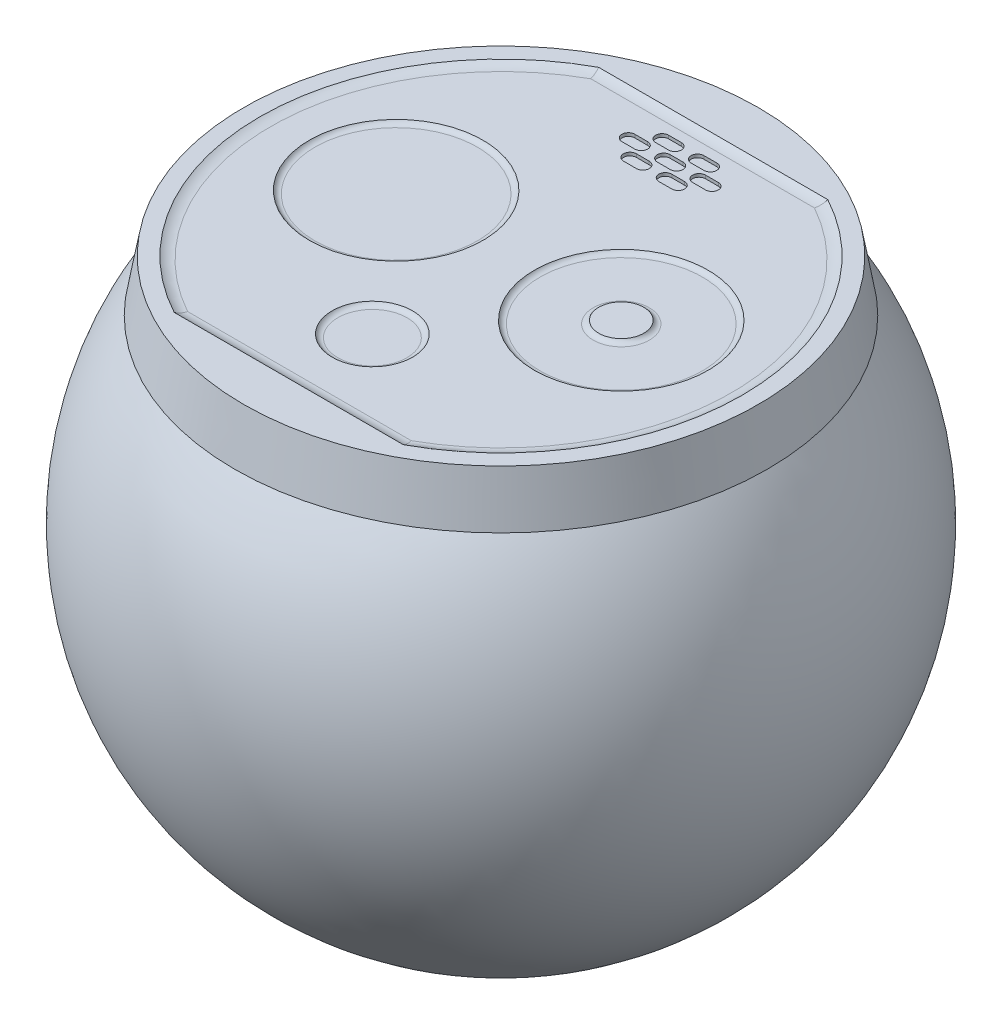
from build123d import *

# Parameters (mm, degrees)
EXTRUDE1_DEPTH = 0.5
FILLET1_R      = 3
SKETCH3_R      = 13.5
SKETCH3_R_2    = 3.5
SKETCH3_R_3    = 6.25
EXTRUDE2_DEPTH = 0.5
FILLET2_R      = 1


with BuildPart() as part:
    # Sketch1 → Revolve1 (revolve)
    with BuildSketch(Plane(origin=(0, 0, 0), x_dir=(0, 0, -1), z_dir=(1, 0, 0))):
        with BuildLine():
            Line((40, 36), (41.424630354, 28))
            ThreePointArc((41.424630354, 28), (44.158804332, -23.452078799), (0, -50))
            Line((0, -50), (0, 36))
            Line((0, 36), (40, 36))
        make_face()
    revolve(axis=Axis((0, 36, 0), (0, -1, 0)))

    # Sketch2 → Extrude1 (cut)
    with BuildSketch(Plane(origin=(0, 36, 0), x_dir=(1, 0, 0), z_dir=(0, 1, 0))):
        with BuildLine():
            Line((17.811513131, 33), (-17.811513131, 33))
            ThreePointArc((-17.811513131, 33), (-37.5, 0), (-17.811513131, -33))
            Line((-17.811513131, -33), (17.811513131, -33))
            ThreePointArc((17.811513131, -33), (32.20389528, -19.213514223), (37.5, 0))
            ThreePointArc((37.5, 0), (32.20389528, 19.213514223), (17.811513131, 33))
        make_face()
    extrude(amount=-EXTRUDE1_DEPTH, mode=Mode.SUBTRACT)

    # Fillet1
    # the kernel refuses this fillet: 3 mm, written as the material it adds along each edge
    with BuildSketch(Plane(origin=(-21.957294119, 35.5, 33), x_dir=(0, 1.0, -3.3253400033406348e-12), z_dir=(1, 0, 0)), Plane(origin=(21.957294119, 35.5, -33), x_dir=(0, 1.0, 3.3253400033406348e-12), z_dir=(-1, 0, 0))) as fillet1_piece_1:
        with BuildLine():
            CenterArc((3, -1.658312395), FILLET1_R, 146.442690238, 33.557309762)
            Line((0, -1.658312395), (0, 0))
            Line((0, 0), (0.5, 0))
        make_face()
    extrude(amount=43.914588237)
    with BuildSketch(Plane(origin=(0, 35.5, 0), x_dir=(0.37490714563861727, 0, 0.9270623669144945), z_dir=(-0.9270623669144945, 0, 0.37490714563861727))) as fillet1_piece_2:
        with BuildLine():
            CenterArc((35.841687605, 3), FILLET1_R, 270, 33.557309762)
            Line((35.841687605, 0), (37.5, 0))
            Line((37.5, 0), (37.5, 0.5))
        make_face()
    revolve(axis=Axis((0, 35.5, 0), (0, 1, 0)), revolution_arc=135.962852024)
    with BuildSketch(Plane(origin=(0, 35.5, 0), x_dir=(-0.37490714563861693, 0, -0.9270623669144946), z_dir=(0.9270623669144946, 0, -0.37490714563861693))) as fillet1_piece_3:
        with BuildLine():
            CenterArc((35.841687605, 3), FILLET1_R, 270, 33.557309762)
            Line((35.841687605, 0), (37.5, 0))
            Line((37.5, 0), (37.5, 0.5))
        make_face()
    revolve(axis=Axis((0, 35.5, 0), (0, 1, 0)), revolution_arc=135.962852024)

    # Sketch3 → Extrude2 (cut)
    # profile 1 of 10: a face of its own
    with BuildSketch(Plane(origin=(0, 35.5, 0), x_dir=(1, 0, 0), z_dir=(0, 1, 0))):
        with Locations(Location((-17.5, 1.2, 0), (0, 0, 270))):
            Circle(SKETCH3_R)
    # profile 2 of 10: a face of its own
    with BuildSketch(Plane(origin=(0, 35.5, 0), x_dir=(1, 0, 0), z_dir=(0, 1, 0))):
        with Locations(Location((17.5, 1.2, 0), (0, 0, 270))):
            Circle(SKETCH3_R)
        with Locations(Location((17.5, 1.2, 0), (0, 0, 270))):
            Circle(SKETCH3_R_2, mode=Mode.SUBTRACT)
    # profile 3 of 10: a face of its own
    with BuildSketch(Plane(origin=(0, 35.5, 0), x_dir=(1, 0, 0), z_dir=(0, 1, 0))):
        with Locations(Location((0, -20, 0), (0, 0, 270))):
            Circle(SKETCH3_R_3)
    # profile 4 of 10: a face of its own
    with BuildSketch(Plane(origin=(0, 35.5, 0), x_dir=(1, 0, 0), z_dir=(0, 1, 0))):
        with BuildLine():
            Line((-3.75, 24.8), (-1.75, 24.8))
            ThreePointArc((-1.75, 24.8), (-0.75, 23.8), (-1.75, 22.8))
            Line((-1.75, 22.8), (-3.75, 22.8))
            ThreePointArc((-3.75, 22.8), (-4.75, 23.8), (-3.75, 24.8))
        make_face()
    # profile 5 of 10: a face of its own
    with BuildSketch(Plane(origin=(0, 35.5, 0), x_dir=(1, 0, 0), z_dir=(0, 1, 0))):
        with BuildLine():
            Line((-6.5, 27.3), (-4.5, 27.3))
            ThreePointArc((-4.5, 27.3), (-3.5, 26.3), (-4.5, 25.3))
            Line((-4.5, 25.3), (-6.5, 25.3))
            ThreePointArc((-6.5, 25.3), (-7.5, 26.3), (-6.5, 27.3))
        make_face()
    # profile 6 of 10: a face of its own
    with BuildSketch(Plane(origin=(0, 35.5, 0), x_dir=(1, 0, 0), z_dir=(0, 1, 0))):
        with BuildLine():
            Line((-1, 27.3), (1, 27.3))
            ThreePointArc((1, 27.3), (2, 26.3), (1, 25.3))
            Line((1, 25.3), (-1, 25.3))
            ThreePointArc((-1, 25.3), (-2, 26.3), (-1, 27.3))
        make_face()
    # profile 7 of 10: a face of its own
    with BuildSketch(Plane(origin=(0, 35.5, 0), x_dir=(1, 0, 0), z_dir=(0, 1, 0))):
        with BuildLine():
            Line((-3.75, 29.8), (-1.75, 29.8))
            ThreePointArc((-1.75, 29.8), (-0.75, 28.8), (-1.75, 27.8))
            Line((-1.75, 27.8), (-3.75, 27.8))
            ThreePointArc((-3.75, 27.8), (-4.75, 28.8), (-3.75, 29.8))
        make_face()
    # profile 8 of 10: a face of its own
    with BuildSketch(Plane(origin=(0, 35.5, 0), x_dir=(1, 0, 0), z_dir=(0, 1, 0))):
        with BuildLine():
            Line((1.75, 29.8), (3.75, 29.8))
            ThreePointArc((3.75, 29.8), (4.75, 28.8), (3.75, 27.8))
            Line((3.75, 27.8), (1.75, 27.8))
            ThreePointArc((1.75, 27.8), (0.75, 28.8), (1.75, 29.8))
        make_face()
    # profile 9 of 10: a face of its own
    with BuildSketch(Plane(origin=(0, 35.5, 0), x_dir=(1, 0, 0), z_dir=(0, 1, 0))):
        with BuildLine():
            Line((4.5, 27.3), (6.5, 27.3))
            ThreePointArc((6.5, 27.3), (7.5, 26.3), (6.5, 25.3))
            Line((6.5, 25.3), (4.5, 25.3))
            ThreePointArc((4.5, 25.3), (3.5, 26.3), (4.5, 27.3))
        make_face()
    # profile 10 of 10: a face of its own
    with BuildSketch(Plane(origin=(0, 35.5, 0), x_dir=(1, 0, 0), z_dir=(0, 1, 0))):
        with BuildLine():
            Line((1.75, 24.8), (3.75, 24.8))
            ThreePointArc((3.75, 24.8), (4.75, 23.8), (3.75, 22.8))
            Line((3.75, 22.8), (1.75, 22.8))
            ThreePointArc((1.75, 22.8), (0.75, 23.8), (1.75, 24.8))
        make_face()
    extrude(amount=-EXTRUDE2_DEPTH, mode=Mode.SUBTRACT)

    # Fillet2
    # the kernel refuses this fillet: 1 mm, written as the material it adds along each edge
    with BuildSketch(Plane(origin=(0, 35, 20), x_dir=(0, 0, 1), z_dir=(-1, 0, 0))) as fillet2_piece_1:
        with BuildLine():
            CenterArc((5.383974596, 1), FILLET2_R, 270, 60)
            Line((5.383974596, 0), (5.383974596, -0.02))
            Line((5.383974596, -0.02), (6.25, -0.02))
            Line((6.25, -0.02), (6.27, 0))
            ThreePointArc((6.27, 0), (6.27, 0.25), (6.267320508, 0.49))
            Line((6.267320508, 0.49), (6.25, 0.5))
        make_face()
    revolve(axis=Axis((0, 35, 20), (0, 1, 0)))
    with BuildSketch(Plane(origin=(17.5, 35, -1.2), x_dir=(0, 0, 1), z_dir=(-1, 0, 0))) as fillet2_piece_2:
        with BuildLine():
            CenterArc((12.633974596, 1), FILLET2_R, 270, 60)
            Line((12.633974596, 0), (12.633974596, -0.02))
            Line((12.633974596, -0.02), (13.5, -0.02))
            Line((13.5, -0.02), (13.52, 0))
            ThreePointArc((13.52, 0), (13.52, 0.25), (13.517320508, 0.49))
            Line((13.517320508, 0.49), (13.5, 0.5))
        make_face()
    revolve(axis=Axis((17.5, 35, -1.2), (0, 1, 0)))
    with BuildSketch(Plane(origin=(17.5, 35, -1.2), x_dir=(0, 0, 1), z_dir=(-1, 0, 0))) as fillet2_piece_3:
        with BuildLine():
            CenterArc((4.366025404, 1), FILLET2_R, 210, 60)
            Line((3.5, 0.5), (3.482679492, 0.49))
            ThreePointArc((3.482679492, 0.49), (3.48, 0.25), (3.48, 0))
            Line((3.48, 0), (3.5, -0.02))
            Line((3.5, -0.02), (4.366025404, -0.02))
            Line((4.366025404, -0.02), (4.366025404, 0))
        make_face()
    revolve(axis=Axis((17.5, 35, -1.2), (0, 1, 0)))
    with BuildSketch(Plane(origin=(-17.5, 35, -1.2), x_dir=(0, 0, 1), z_dir=(-1, 0, 0))) as fillet2_piece_4:
        with BuildLine():
            CenterArc((12.633974596, 1), FILLET2_R, 270, 60)
            Line((12.633974596, 0), (12.633974596, -0.02))
            Line((12.633974596, -0.02), (13.5, -0.02))
            Line((13.5, -0.02), (13.52, 0))
            ThreePointArc((13.52, 0), (13.52, 0.25), (13.517320508, 0.49))
            Line((13.517320508, 0.49), (13.5, 0.5))
        make_face()
    revolve(axis=Axis((-17.5, 35, -1.2), (0, 1, 0)))


solid = part.part
